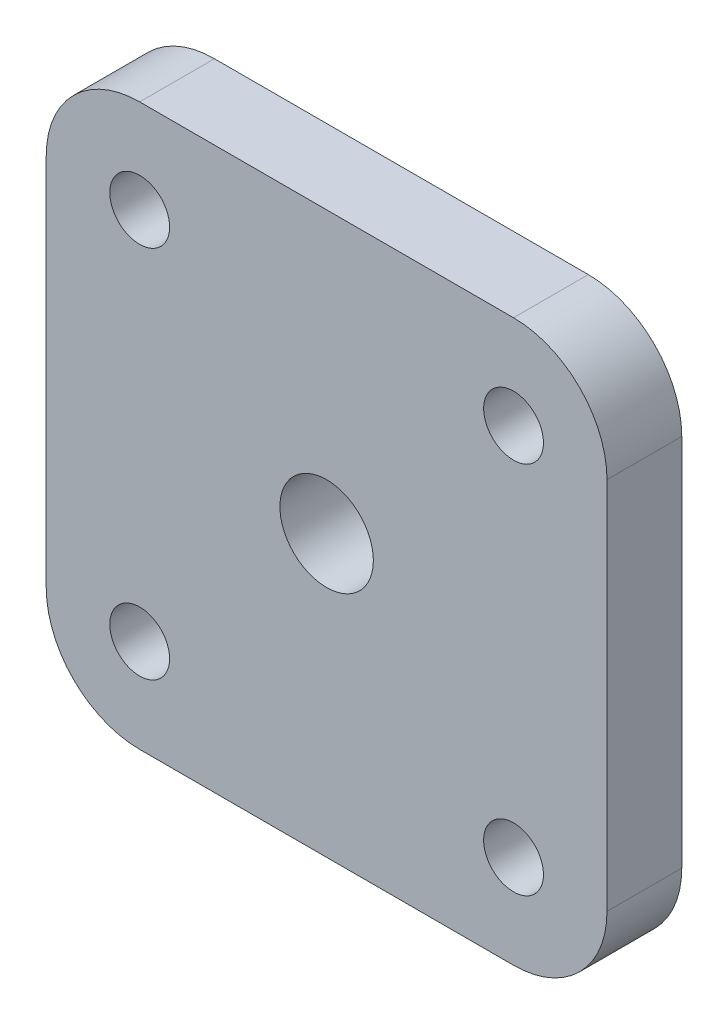
from build123d import *

# Parameters (mm, degrees)
SKETCH1_W           = 30
SKETCH1_H           = 30
BOSS_EXTRUDE1_DEPTH = 4
SKETCH3_R           = 1.6
DOWEL_CUT_DEPTH     = 22.587033145
SKETCH2_R           = 2.5
SCREW_CUT_DEPTH     = 22.587033145
FILLET1_R           = 5


with BuildPart() as part:
    # Sketch1 → Boss-Extrude1 (new body)
    with BuildSketch(Plane.XY):
        Rectangle(SKETCH1_W, SKETCH1_H)
    extrude(amount=BOSS_EXTRUDE1_DEPTH)

    # Sketch3 → Dowel cut (cut, through all)
    with BuildSketch(Plane.XY.offset(4)):
        with Locations((-10, 10)):
            Circle(SKETCH3_R)
        with Locations((10, 10)):
            Circle(SKETCH3_R)
        with Locations((10, -10)):
            Circle(SKETCH3_R)
        with Locations((-10, -10)):
            Circle(SKETCH3_R)
    extrude(amount=-DOWEL_CUT_DEPTH, mode=Mode.SUBTRACT)

    # Sketch2 → Screw cut (cut, through all)
    with BuildSketch(Plane.XY.offset(4)):
        Circle(SKETCH2_R)
    extrude(amount=-SCREW_CUT_DEPTH, mode=Mode.SUBTRACT)

    # Fillet1
    fillet1_edges = [part.edges().sort_by_distance(p)[0] for p in [
        (15, -15, 2),
        (-15, -15, 2),
        (-15, 15, 2),
        (15, 15, 2),
    ]]
    fillet(fillet1_edges, radius=FILLET1_R)


solid = part.part
